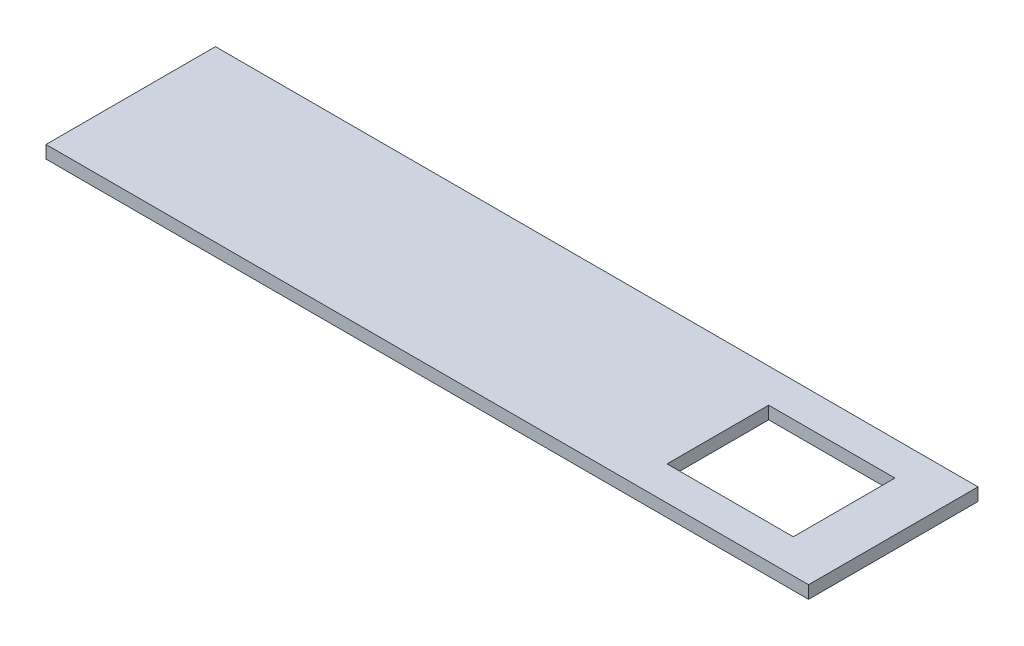
from build123d import *

# Parameters (mm, degrees)
SKETCH1_W           = 900
SKETCH1_H           = 200
SKETCH1_W_2         = 149
SKETCH1_H_2         = 120
BOSS_EXTRUDE1_DEPTH = 15


with BuildPart() as part:
    # Sketch1 → Boss-Extrude1 (new body)
    with BuildSketch(Plane(origin=(0, 0, 0), x_dir=(1, 0, 0), z_dir=(0, 1, 0))):
        Rectangle(SKETCH1_W, SKETCH1_H)
        with Locations((317.5, 0)):
            Rectangle(SKETCH1_W_2, SKETCH1_H_2, mode=Mode.SUBTRACT)
    extrude(amount=BOSS_EXTRUDE1_DEPTH)


solid = part.part
